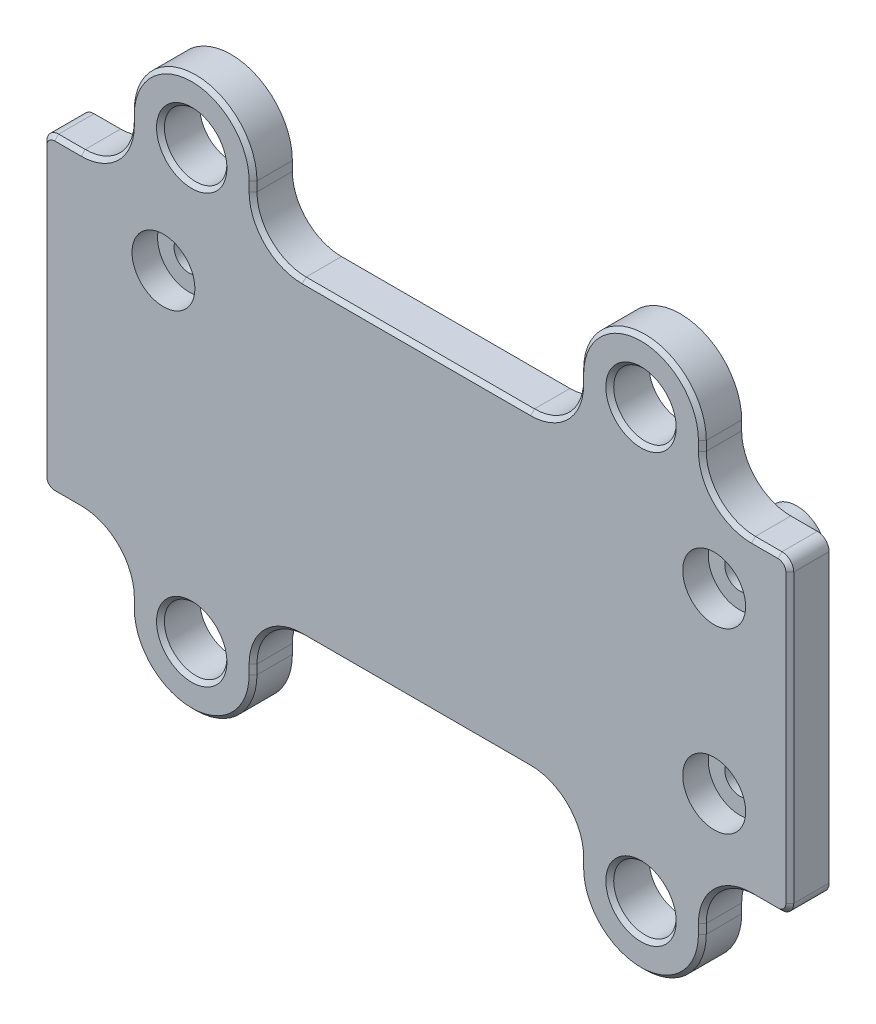
from build123d import *
from build123d.topology import SkipClean

# Parameters (mm, degrees)
SKETCH1_W            = 48.26
SKETCH1_H            = 35.56
BOSS_EXTRUDE1_DEPTH  = 4.445
SKETCH2_OUTSIDE_W    = 62.282
SKETCH2_OUTSIDE_H    = 49.582
CUT_EXTRUDE2_DEPTH   = 61.110724709
SKETCH3_R            = 2.0193
CUT_EXTRUDE3_DEPTH   = 61.110724709
CHAMFER1_SIZE        = 0.254
SKETCH4_OUTSIDE_W    = 62.282
SKETCH4_OUTSIDE_H    = 49.582
SKETCH4_OUTSIDE_W_2  = 12.446
SKETCH4_OUTSIDE_H_2  = 1.524
CUT_EXTRUDE4_DEPTH   = 1.905
SKETCH16_W           = 12.446
SKETCH16_H           = 1.524
BOSS_EXTRUDE12_DEPTH = 1.27
CUT_EXTRUDE5_DEPTH   = 1.016
BOSS_EXTRUDE2_DEPTH  = 1.016
F_3DSKETCH1_R        = 0.9652
F_3DSKETCH1_R_2      = 0.5715
CUT_EXTRUDE6_DEPTH   = 48.4925664
SKETCH7_R            = 0.5715
CUT_EXTRUDE7_DEPTH   = 2.54
SKETCH9_W            = 4.902032443
SKETCH9_H            = 4.572
SKETCH9_R            = 0.9652
SKETCH9_W_2          = 6.35
SKETCH9_H_2          = 4.497155915
SKETCH9_H_3          = 4.013032443
BOSS_EXTRUDE8_DEPTH  = 1.016
SKETCH8_R            = 2.032
CUT_EXTRUDE8_DEPTH   = 1.651
CHAMFER4_SIZE        = 0.127
FILLET1_R            = 3.175
SKETCH11_R           = 1.9558
SKETCH11_R_2         = 0.9652
BOSS_EXTRUDE9_DEPTH  = 2.794
FILLET2_R            = 2.54
FILLET3_R            = 0.7874
BOSS_EXTRUDE10_DEPTH = 1.016
BOSS_EXTRUDE11_DEPTH = 1.016
FILLET4_START        = 1.905
FILLET4_DEPTH        = 2.095
CHAMFER6_DEPTH       = 1.905
DRAFT1_ANGLE         = 3


with BuildPart() as part:
    # Sketch1 → Boss-Extrude1 (new body)
    with BuildSketch(Plane.XY):
        with Locations((24.13, 17.78)):
            Rectangle(SKETCH1_W, SKETCH1_H)
    extrude(amount=BOSS_EXTRUDE1_DEPTH)

    # Sketch2 outside → Cut-Extrude2 (cut, through all)
    with BuildSketch(Plane.XY.offset(4.445)):
        with Locations((24.13, 17.78)):
            Rectangle(SKETCH2_OUTSIDE_W, SKETCH2_OUTSIDE_H)
        with BuildLine():
            Line((0.762, 7.747), (2.4765, 7.747))
            ThreePointArc((2.4765, 7.747), (4.72156403, 6.81706403), (5.6515, 4.572))
            Line((5.6515, 4.572), (5.6515, 3.9624))
            ThreePointArc((5.6515, 3.9624), (9.6139, 0), (13.5763, 3.9624))
            Line((13.5763, 3.9624), (13.5763, 4.572))
            ThreePointArc((13.5763, 4.572), (14.50623597, 6.81706403), (16.7513, 7.747))
            Line((16.7513, 7.747), (31.5087, 7.747))
            ThreePointArc((31.5087, 7.747), (33.75376403, 6.81706403), (34.6837, 4.572))
            Line((34.6837, 4.572), (34.6837, 3.9624))
            ThreePointArc((34.6837, 3.9624), (38.6461, 0), (42.6085, 3.9624))
            Line((42.6085, 3.9624), (42.6085, 4.572))
            ThreePointArc((42.6085, 4.572), (43.53843597, 6.81706403), (45.7835, 7.747))
            Line((45.7835, 7.747), (47.498, 7.747))
            ThreePointArc((47.498, 7.747), (48.036815367, 7.970184633), (48.26, 8.509))
            Line((48.26, 8.509), (48.26, 27.051))
            ThreePointArc((48.26, 27.051), (48.036815367, 27.589815367), (47.498, 27.813))
            Line((47.498, 27.813), (45.7835, 27.813))
            ThreePointArc((45.7835, 27.813), (43.53843597, 28.74293597), (42.6085, 30.988))
            Line((42.6085, 30.988), (42.6085, 31.5976))
            ThreePointArc((42.6085, 31.5976), (38.6461, 35.56), (34.6837, 31.5976))
            Line((34.6837, 31.5976), (34.6837, 30.988))
            ThreePointArc((34.6837, 30.988), (33.75376403, 28.74293597), (31.5087, 27.813))
            Line((31.5087, 27.813), (16.7513, 27.813))
            ThreePointArc((16.7513, 27.813), (14.50623597, 28.74293597), (13.5763, 30.988))
            Line((13.5763, 30.988), (13.5763, 31.5976))
            ThreePointArc((13.5763, 31.5976), (9.6139, 35.56), (5.6515, 31.5976))
            Line((5.6515, 31.5976), (5.6515, 30.988))
            ThreePointArc((5.6515, 30.988), (4.72156403, 28.74293597), (2.4765, 27.813))
            Line((2.4765, 27.813), (0.762, 27.813))
            ThreePointArc((0.762, 27.813), (0.223184633, 27.589815367), (0, 27.051))
            Line((0, 27.051), (0, 8.509))
            ThreePointArc((0, 8.509), (0.223184633, 7.970184633), (0.762, 7.747))
        make_face(mode=Mode.SUBTRACT)
    extrude(amount=-CUT_EXTRUDE2_DEPTH, mode=Mode.SUBTRACT)

    # Sketch3 → Cut-Extrude3 (cut, through all)
    with BuildSketch(Plane.XY.offset(4.445)):
        with Locations((9.6139, 31.5976)):
            Circle(SKETCH3_R)
        with Locations((38.6461, 31.5976)):
            Circle(SKETCH3_R)
        with Locations((38.6461, 3.9624)):
            Circle(SKETCH3_R)
        with Locations((9.6139, 3.9624)):
            Circle(SKETCH3_R)
    extrude(amount=-CUT_EXTRUDE3_DEPTH, mode=Mode.SUBTRACT)

    # Chamfer1
    chamfer1_edges = [part.edges().sort_by_distance(p)[0] for p in [
        (7.5946, 31.5976, 4.445),
        (36.6268, 31.5976, 4.445),
        (36.6268, 3.9624, 4.445),
        (7.5946, 3.9624, 4.445),
        (0, 17.78, 4.445),
        (48.26, 17.78, 4.445),
        (9.6139, 35.56, 4.445),
        (38.6461, 35.56, 4.445),
        (38.6461, 0, 4.445),
        (9.6139, 0, 4.445),
        (4.72156403, 6.81706403, 4.445),
        (1.61925, 7.747, 4.445),
        (0.223184633, 7.970184633, 4.445),
        (0.223184633, 27.589815367, 4.445),
        (1.61925, 27.813, 4.445),
        (4.72156403, 28.74293597, 4.445),
        (5.6515, 31.2928, 4.445),
        (13.5763, 31.2928, 4.445),
        (14.50623597, 28.74293597, 4.445),
        (24.13, 27.813, 4.445),
        (33.75376403, 28.74293597, 4.445),
        (34.6837, 31.2928, 4.445),
        (42.6085, 31.2928, 4.445),
        (43.53843597, 28.74293597, 4.445),
        (46.64075, 27.813, 4.445),
        (48.036815367, 27.589815367, 4.445),
        (48.036815367, 7.970184633, 4.445),
        (46.64075, 7.747, 4.445),
        (43.53843597, 6.81706403, 4.445),
        (42.6085, 4.2672, 4.445),
        (34.6837, 4.2672, 4.445),
        (33.75376403, 6.81706403, 4.445),
        (24.13, 7.747, 4.445),
        (14.50623597, 6.81706403, 4.445),
        (13.5763, 4.2672, 4.445),
        (5.6515, 4.2672, 4.445),
    ]]
    chamfer(chamfer1_edges, length=CHAMFER1_SIZE)

    # Sketch4 outside → Cut-Extrude4 (cut)
    with BuildSketch(Plane(origin=(0, 0, 0), x_dir=(-1, 0, 0), z_dir=(0, 0, -1))):
        with Locations((-24.13, 17.78)):
            Rectangle(SKETCH4_OUTSIDE_W, SKETCH4_OUTSIDE_H)
        with Locations((-22.225, 8.509)):
            Rectangle(SKETCH4_OUTSIDE_W_2, SKETCH4_OUTSIDE_H_2, mode=Mode.SUBTRACT)
    extrude(amount=-CUT_EXTRUDE4_DEPTH, mode=Mode.SUBTRACT)

    # Sketch16 → Boss-Extrude12 (add)
    with BuildSketch(Plane(origin=(0, 0, 0), x_dir=(-1, 0, 0), z_dir=(0, 0, -1))):
        with Locations((-22.225, 8.509)):
            Rectangle(SKETCH16_W, SKETCH16_H)
    extrude(amount=BOSS_EXTRUDE12_DEPTH)

    # Sketch5 → Cut-Extrude5 (cut)
    with BuildSketch(Plane(origin=(0, 0, 1.905), x_dir=(-1, 0, 0), z_dir=(0, 0, -1))):
        with BuildLine():
            Line((-44.6278, 10.414), (-3.6322, 10.414))
            ThreePointArc((-3.6322, 10.414), (-3.039503096, 10.659503096), (-2.794, 11.2522))
            Line((-2.794, 11.2522), (-2.794, 24.3078))
            ThreePointArc((-2.794, 24.3078), (-3.039503096, 24.900496904), (-3.6322, 25.146))
            Line((-3.6322, 25.146), (-44.6278, 25.146))
            ThreePointArc((-44.6278, 25.146), (-45.220496904, 24.900496904), (-45.466, 24.3078))
            Line((-45.466, 24.3078), (-45.466, 11.2522))
            ThreePointArc((-45.466, 11.2522), (-45.220496904, 10.659503096), (-44.6278, 10.414))
        make_face()
    extrude(amount=-CUT_EXTRUDE5_DEPTH, mode=Mode.SUBTRACT)

    # Sketch6 → Boss-Extrude2 (add)
    with BuildSketch(Plane(origin=(0, 0, 1.905), x_dir=(-1, 0, 0), z_dir=(0, 0, -1))):
        with BuildLine():
            Line((-2.54, 9.2075), (-6.553032443, 9.2075))
            Line((-6.553032443, 9.2075), (-6.807032443, 9.4615))
            Line((-6.807032443, 9.4615), (-6.807032443, 10.16))
            Line((-6.807032443, 10.16), (-6.553032443, 10.414))
            Line((-6.553032443, 10.414), (-3.632032443, 10.414))
            ThreePointArc((-3.632032443, 10.414), (-3.03945402, 10.65945402), (-2.794, 11.252032443))
            Line((-2.794, 11.252032443), (-2.794, 14.173032443))
            Line((-2.794, 14.173032443), (-2.54, 14.427032443))
            Line((-2.54, 14.427032443), (-1.905, 14.427032443))
            Line((-1.905, 14.427032443), (-1.651, 14.173032443))
            Line((-1.651, 14.173032443), (-1.651, 10.0965))
            ThreePointArc((-1.651, 10.0965), (-1.911382072, 9.467882072), (-2.54, 9.2075))
        make_face()
        with BuildLine():
            Line((-2.54, 26.3525), (-6.8072, 26.3525))
            Line((-6.8072, 26.3525), (-6.8072, 26.2255))
            Line((-6.8072, 26.2255), (-6.8072, 25.273))
            Line((-6.8072, 25.273), (-6.8072, 25.146))
            Line((-6.8072, 25.146), (-3.632032443, 25.146))
            ThreePointArc((-3.632032443, 25.146), (-3.03945402, 24.90054598), (-2.794, 24.307967557))
            Line((-2.794, 24.307967557), (-2.794, 21.386967557))
            Line((-2.794, 21.386967557), (-2.54, 21.132967557))
            Line((-2.54, 21.132967557), (-1.905, 21.132967557))
            Line((-1.905, 21.132967557), (-1.651, 21.386967557))
            Line((-1.651, 21.386967557), (-1.651, 25.4635))
            ThreePointArc((-1.651, 25.4635), (-1.911382072, 26.092117928), (-2.54, 26.3525))
        make_face()
        with BuildLine():
            Line((-46.609, 10.0965), (-46.609, 14.301381018))
            Line((-46.609, 14.301381018), (-46.609, 14.427032443))
            Line((-46.609, 14.427032443), (-45.593, 14.427032443))
            Line((-45.593, 14.427032443), (-45.466, 14.427032443))
            Line((-45.466, 14.427032443), (-45.466, 11.252032443))
            ThreePointArc((-45.466, 11.252032443), (-45.22054598, 10.65945402), (-44.627967557, 10.414))
            Line((-44.627967557, 10.414), (-40.563967557, 10.414))
            Line((-40.563967557, 10.414), (-40.563967557, 10.287))
            Line((-40.563967557, 10.287), (-40.563967557, 9.3345))
            Line((-40.563967557, 9.3345), (-40.563967557, 9.2075))
            Line((-40.563967557, 9.2075), (-45.72, 9.2075))
            ThreePointArc((-45.72, 9.2075), (-46.348617928, 9.467882072), (-46.609, 10.0965))
        make_face()
        with BuildLine():
            Line((-45.593, 21.132967557), (-46.609, 21.132967557))
            Line((-46.609, 21.132967557), (-46.609, 21.2598))
            Line((-46.609, 21.2598), (-46.609, 25.4635))
            ThreePointArc((-46.609, 25.4635), (-46.348617928, 26.092117928), (-45.72, 26.3525))
            Line((-45.72, 26.3525), (-40.563967557, 26.3525))
            Line((-40.563967557, 26.3525), (-40.563967557, 26.2255))
            Line((-40.563967557, 26.2255), (-40.563967557, 25.273))
            Line((-40.563967557, 25.273), (-40.563967557, 25.146))
            Line((-40.563967557, 25.146), (-44.627967557, 25.146))
            ThreePointArc((-44.627967557, 25.146), (-45.22054598, 24.90054598), (-45.466, 24.307967557))
            Line((-45.466, 24.307967557), (-45.466, 21.132967557))
            Line((-45.466, 21.132967557), (-45.593, 21.132967557))
        make_face()
        Polygon((-26.5176, 26.0985), (-26.2636, 26.3525), (-21.9964, 26.3525), (-21.7424, 26.0985), (-21.7424, 25.4), (-21.9964, 25.146), (-26.2636, 25.146), (-26.5176, 25.4), align=None)
    extrude(amount=BOSS_EXTRUDE2_DEPTH)

    # 3DSketch1 → Cut-Extrude6 (cut, through all)
    # profile 1 of 3: a face of its own
    with BuildSketch(Plane(origin=(7.786455915, 23.823844085, -2.6162), x_dir=(0.9516958120786183, -0.3070424747034511, 0), z_dir=(0, 0, 1))):
        with Locations(Location((33.866476151, 10.926229279, 0), (0, 0, 17.88108636))):
            Circle(F_3DSKETCH1_R)
        with Locations(Location((33.866476151, 10.926229279, 0), (0, 0, 17.88108636))):
            Circle(F_3DSKETCH1_R_2, mode=Mode.SUBTRACT)
    # profile 2 of 3: a face of its own
    with BuildSketch(Plane(origin=(7.786455915, 23.823844085, -2.6162), x_dir=(0.9516958120786183, -0.3070424747034511, 0), z_dir=(0, 0, 1))):
        with Locations(Location((37.391569395, 0, 0), (0, 0, 17.88108636))):
            Circle(F_3DSKETCH1_R)
        with Locations(Location((37.391569395, 0, 0), (0, 0, 17.88108636))):
            Circle(F_3DSKETCH1_R_2, mode=Mode.SUBTRACT)
    # profile 3 of 3: a face of its own
    with BuildSketch(Plane(origin=(7.786455915, 23.823844085, -2.6162), x_dir=(0.9516958120786183, -0.3070424747034511, 0), z_dir=(0, 0, 1))):
        with Locations(Location((0, 0, 0), (0, 0, 17.88108636))):
            Circle(F_3DSKETCH1_R)
        with Locations(Location((0, 0, 0), (0, 0, 17.88108636))):
            Circle(F_3DSKETCH1_R_2, mode=Mode.SUBTRACT)
    extrude(amount=CUT_EXTRUDE6_DEPTH, mode=Mode.SUBTRACT)


with BuildPart() as cut_extrude6_piece_1:
    # of the separate pieces the step leaves, piece 1, a body of its own (cut_extrude6_pieces)
    add(part.part.solids().sort_by_distance((5.6515, 3.9624, 4.191))[0])

    # Sketch9 → Boss-Extrude8 (add)
    # profile 1 of 3: a face of its own
    with BuildSketch(Plane(origin=(0, 0, 2.921), x_dir=(-1, 0, 0), z_dir=(0, 0, -1))):
        with Locations((-43.014983779, 12.7)):
            Rectangle(SKETCH9_W, SKETCH9_H)
        with Locations(Location((-43.371855915, 12.343044085, 0), (0, 0, 180))):
            Circle(SKETCH9_R, mode=Mode.SUBTRACT)
    # profile 2 of 3: a face of its own
    with BuildSketch(Plane(origin=(0, 0, 2.921), x_dir=(-1, 0, 0), z_dir=(0, 0, -1))):
        with Locations((-7.786455915, 22.897422043)):
            Rectangle(SKETCH9_W_2, SKETCH9_H_2)
        with Locations(Location((-7.786455915, 23.823844085, 0), (0, 0, 180))):
            Circle(SKETCH9_R, mode=Mode.SUBTRACT)
    # profile 3 of 3: a face of its own
    with BuildSketch(Plane(origin=(0, 0, 2.921), x_dir=(-1, 0, 0), z_dir=(0, 0, -1))):
        with Locations((-43.014983779, 23.139483779)):
            Rectangle(SKETCH9_W, SKETCH9_H_3)
        with Locations(Location((-43.371855915, 23.823844085, 0), (0, 0, 180))):
            Circle(SKETCH9_R, mode=Mode.SUBTRACT)
    extrude(amount=BOSS_EXTRUDE8_DEPTH)

    # Sketch8 → Cut-Extrude8 (cut)
    with BuildSketch(Plane.XY.offset(4.445)):
        with Locations((7.786455915, 23.823844085)):
            Circle(SKETCH8_R)
        with Locations((43.371855915, 23.823844085)):
            Circle(SKETCH8_R)
        with Locations((43.371855915, 12.343044085)):
            Circle(SKETCH8_R)
    extrude(amount=-CUT_EXTRUDE8_DEPTH, mode=Mode.SUBTRACT)

    # Chamfer4
    chamfer4_edges = [cut_extrude6_piece_1.edges().sort_by_distance(p)[0] for p in [
        (24.13, 26.3525, 0.889),
        (26.3906, 26.2255, 0.889),
        (26.5176, 25.74925, 0.889),
        (26.3906, 25.273, 0.889),
        (24.13, 25.146, 0.889),
        (21.8694, 25.273, 0.889),
        (21.7424, 25.74925, 0.889),
        (21.8694, 26.2255, 0.889),
    ]]
    chamfer(chamfer4_edges, length=CHAMFER4_SIZE)

    # Fillet1
    fillet1_edges = [cut_extrude6_piece_1.edges().sort_by_distance(p)[0] for p in [
        (10.961455915, 20.648844085, 2.413),
        (4.611455915, 20.648844085, 2.413),
    ]]
    fillet(fillet1_edges, radius=FILLET1_R - 0.0001)  # a hair under: the kernel refuses the full size

    # Sketch11 → Boss-Extrude9 (add)
    # profile 1 of 3: a face of its own
    with BuildSketch(Plane(origin=(0, 0, 1.905), x_dir=(-1, 0, 0), z_dir=(0, 0, -1))):
        with Locations(Location((-43.371855915, 23.823844085, 0), (0, 0, 138.510032486))):
            Circle(SKETCH11_R)
        with Locations(Location((-43.371855915, 23.823844085, 0), (0, 0, 180))):
            Circle(SKETCH11_R_2, mode=Mode.SUBTRACT)
    # profile 2 of 3: a face of its own
    with BuildSketch(Plane(origin=(0, 0, 1.905), x_dir=(-1, 0, 0), z_dir=(0, 0, -1))):
        with Locations(Location((-43.371855915, 12.343044085, 0), (0, 0, 260.511847353))):
            Circle(SKETCH11_R)
        with Locations(Location((-43.371855915, 12.343044085, 0), (0, 0, 180))):
            Circle(SKETCH11_R_2, mode=Mode.SUBTRACT)
    # profile 3 of 3: a face of its own
    with BuildSketch(Plane(origin=(0, 0, 1.905), x_dir=(-1, 0, 0), z_dir=(0, 0, -1))):
        with Locations(Location((-7.786455915, 23.823844085, 0), (0, 0, 59.954122435))):
            Circle(SKETCH11_R)
        with Locations(Location((-7.786455915, 23.823844085, 0), (0, 0, 180))):
            Circle(SKETCH11_R_2, mode=Mode.SUBTRACT)
    extrude(amount=BOSS_EXTRUDE9_DEPTH)

    # Fillet2
    fillet2_edges = [cut_extrude6_piece_1.edges().sort_by_distance(p)[0] for p in [
        (40.563967557, 21.132967557, 2.413),
        (40.563967557, 14.986, 2.413),
    ]]
    fillet(fillet2_edges, radius=FILLET2_R)

    # Fillet3
    # the kernel refuses this fillet: 0.7874 mm, written as the material it adds along each edge
    with BuildSketch(Plane(origin=(41.930655936, 25.146, 0.889), x_dir=(-1, 0, 0), z_dir=(0, 0, 1))) as fillet3_piece_1:
        with BuildLine():
            CenterArc((1.249372889, 0.7874), FILLET3_R, 168.758855809, 101.241144191)
            Line((0.477078825, 0.940894753), (0.461632944, 0.943964648))
            ThreePointArc((0.461632944, 0.943964648), (0.289129693, 0.444795675), (-0.011604467, 0.010645931))
            Line((-0.011604467, 0.010645931), (0, -0.015748))
            Line((0, -0.015748), (1.249372889, -0.015748))
            Line((1.249372889, -0.015748), (1.249372889, 0))
        make_face()
    extrude(amount=1.016)
    with BuildSketch(Plane(origin=(43.049454679, 10.414, 0.889), x_dir=(-1, 0, 0), z_dir=(0, 0, 1))) as fillet3_piece_2:
        with BuildLine():
            CenterArc((2.17195139, -0.7874), FILLET3_R, 90, 114.593168844)
            Line((1.455979803, -1.115094136), (1.441660371, -1.121648018))
            ThreePointArc((1.441660371, -1.121648018), (0.857216562, -0.388815656), (-0.002595958, -0.015532563))
            Line((-0.002595958, -0.015532563), (0, 0.015748))
            Line((0, 0.015748), (2.17195139, 0.015748))
            Line((2.17195139, 0.015748), (2.17195139, 0))
        make_face()
    extrude(amount=1.016)
    with BuildSketch(Plane(origin=(6.345255936, 25.146, 0.889), x_dir=(-0.4522354245640404, -0.8918986045338236, 0), z_dir=(0, 0, 1))) as fillet3_piece_3:
        with BuildLine():
            CenterArc((1.26729164, -0.758223763), FILLET3_R, 105.646052984, 101.241144191)
            Line((0.565010679, -1.114313936), (0.550965059, -1.121435739))
            Line((0.550965059, -1.121435739), (-0.014045619, -0.007121803))
            Line((-0.014045619, -0.007121803), (0.00424714, 0.015164475))
            ThreePointArc((0.00424714, 0.015164475), (0.527467331, -0.056722009), (1.050687523, 0.015164475))
            Line((1.050687523, 0.015164475), (1.054934662, 0))
        make_face()
    extrude(amount=1.016)
    with BuildSketch(Plane(origin=(6.8072, 25.516833008, 1.905), x_dir=(5.384336008781321e-12, 1.0, 0), z_dir=(0, 0, -1))) as fillet3_piece_4:
        with BuildLine():
            CenterArc((1.041437811, 0.760037585), FILLET3_R, 175.416414294, 79.434623289)
            Line((0.256556063, 0.822961364), (0.240858428, 0.82421984))
            ThreePointArc((0.240858428, 0.82421984), (0.159148279, 0.401856963), (-0.013631859, 0.007884918))
            Line((-0.013631859, 0.007884918), (0, -0.015748))
            ThreePointArc((0, -0.015748), (0.417833496, -0.015748), (0.831551575, -0.015200752))
            Line((0.831551575, -0.015200752), (0.835666992, 0))
        make_face()
    extrude(amount=1.016)

    # Sketch14 → Boss-Extrude10 (add)
    with BuildSketch(Plane(origin=(0, 0, 1.905), x_dir=(-1, 0, 0), z_dir=(0, 0, -1))):
        with BuildLine():
            Line((-45.466, 21.645595789), (-45.466, 24.307967557))
            ThreePointArc((-45.466, 24.307967557), (-45.290305275, 24.821394399), (-44.836890412, 25.119539868))
            ThreePointArc((-44.836890412, 25.119539868), (-44.654501698, 25.300317395), (-44.45, 25.455640326))
            Line((-44.45, 25.455640326), (-44.45, 22.192047845))
            ThreePointArc((-44.45, 22.192047845), (-45.121284698, 22.222411585), (-45.466, 21.645595789))
        make_face()
    extrude(amount=BOSS_EXTRUDE10_DEPTH)

    # Sketch15 → Boss-Extrude11 (add)
    with BuildSketch(Plane(origin=(0, 0, 1.905), x_dir=(-1, 0, 0), z_dir=(0, 0, -1))):
        with BuildLine():
            Line((-45.466, 11.252032443), (-45.466, 14.427032443))
            ThreePointArc((-45.466, 14.427032443), (-44.993320854, 13.978588304), (-44.344640805, 14.039759499))
            ThreePointArc((-44.344640805, 14.039759499), (-44.271144143, 14.079832594), (-44.196, 14.116723923))
            Line((-44.196, 14.116723923), (-44.45, 13.251247845))
            Line((-44.45, 13.251247845), (-44.45, 10.711247845))
            ThreePointArc((-44.45, 10.711247845), (-44.087726622, 10.522966403), (-43.69425715, 10.414))
            Line((-43.69425715, 10.414), (-44.627967557, 10.414))
            ThreePointArc((-44.627967557, 10.414), (-45.22054598, 10.65945402), (-45.466, 11.252032443))
        make_face()
    extrude(amount=BOSS_EXTRUDE11_DEPTH)

    # Fillet4: read off the stored shape, not the designer's step
    # Fillet4 outline → Fillet4 (add)
    with BuildSketch(Plane.XY.offset(FILLET4_START)):
        with BuildLine():
            Line((10.961455915, 25.146), (10.961455915, 24.3586))
            ThreePointArc((10.961455915, 24.3586), (11.192080035, 24.91537588), (11.748855915, 25.146))
            Line((11.748855915, 25.146), (10.961455915, 25.146))
        make_face()
        with BuildLine():
            Line((40.563967557, 25.146), (39.776567557, 25.146))
            ThreePointArc((39.776567557, 25.146), (40.333343437, 24.91537588), (40.563967557, 24.3586))
            Line((40.563967557, 24.3586), (40.563967557, 25.146))
        make_face()
        with BuildLine():
            Line((4.611455915, 25.146), (3.824055915, 25.146))
            ThreePointArc((3.824055915, 25.146), (4.380831794, 24.915375879), (4.611455915, 24.3586))
            Line((4.611455915, 24.3586), (4.611455915, 25.146))
        make_face()
        with BuildLine():
            Line((40.563967557, 10.414), (40.563967557, 11.2014))
            ThreePointArc((40.563967557, 11.2014), (40.333343437, 10.64462412), (39.776567557, 10.414))
            Line((39.776567557, 10.414), (40.563967557, 10.414))
        make_face()
        with BuildLine():
            Line((45.466, 14.986), (45.466, 15.7734))
            ThreePointArc((45.466, 15.7734), (45.23537588, 15.21662412), (44.6786, 14.986))
            Line((44.6786, 14.986), (45.466, 14.986))
        make_face()
        with BuildLine():
            ThreePointArc((44.6786, 21.132967557), (45.235375879, 20.902343436), (45.466, 20.345567557))
            Line((45.466, 20.345567557), (45.466, 21.132967557))
            Line((45.466, 21.132967557), (44.6786, 21.132967557))
        make_face()
    extrude(amount=FILLET4_DEPTH)

    # Chamfer6: read off the stored shape, not the designer's step
    # Chamfer6 outline → Chamfer6 (cut)
    with SkipClean():  # the faces are left unmerged after this step: merging them gives an invalid solid
        with BuildSketch(Plane.XY):
            with BuildLine():
                Line((6.619572376, 26.3525), (6.917378711, 26.113656149))
                ThreePointArc((6.917378711, 26.113656149), (6.852245555, 26.228444868), (6.8072, 26.3525))
                Line((6.8072, 26.3525), (6.619572376, 26.3525))
            make_face()
            Polygon((45.466, 21.132967557), (45.72, 21.132967557), (45.466, 21.386967557), align=None)
            Polygon((46.609, 21.386967557), (46.355, 21.132967557), (46.609, 21.132967557), align=None)
            Polygon((40.563967557, 26.3525), (40.563967557, 26.0985), (40.817967557, 26.3525), align=None)
            with BuildLine():
                Line((40.784629872, 25.139188364), (40.563967557, 25.390991062))
                Line((40.563967557, 25.390991062), (40.563967557, 25.146))
                Line((40.563967557, 25.146), (40.681283048, 25.146))
                ThreePointArc((40.681283048, 25.146), (40.733068578, 25.144295246), (40.784629872, 25.139188364))
            make_face()
            Polygon((46.609, 14.427032443), (46.355, 14.427032443), (46.609, 14.173032443), align=None)
            with BuildLine():
                Line((45.279998761, 14.15331758), (45.926936637, 14.427032443))
                Line((45.926936637, 14.427032443), (45.466, 14.427032443))
                ThreePointArc((45.466, 14.427032443), (45.387541521, 14.28029299), (45.279998761, 14.15331758))
            make_face()
            Polygon((40.563967557, 10.414), (40.563967557, 10.16), (40.817967557, 10.414), align=None)
            Polygon((40.817967557, 9.2075), (40.563967557, 9.4615), (40.563967557, 9.2075), align=None)
        extrude(amount=CHAMFER6_DEPTH, mode=Mode.SUBTRACT)

    # Draft1
    draft1_faces = [cut_extrude6_piece_1.faces().sort_by_distance(p)[0] for p in [
        (16.002, 8.509, 0.3175),
        (28.448, 8.509, 0.3175),
    ]]
    draft(draft1_faces, Plane(origin=(0, 0, 1.905), x_dir=(-1, 0, 0), z_dir=(0, 0, -1)), DRAFT1_ANGLE)


with BuildPart() as cut_extrude6_piece_2:
    # of the separate pieces the step leaves, piece 2, a body of its own (cut_extrude6_pieces)
    add(part.part.solids().sort_by_distance((8.357955915, 23.823844085, 4.445))[0])


with BuildPart() as cut_extrude6_piece_3:
    # of the separate pieces the step leaves, piece 3, a body of its own (cut_extrude6_pieces)
    add(part.part.solids().sort_by_distance((43.943355915, 12.343044085, 4.445))[0])


with BuildPart() as cut_extrude6_piece_4:
    # of the separate pieces the step leaves, piece 4, a body of its own (cut_extrude6_pieces)
    add(part.part.solids().sort_by_distance((43.943355915, 23.823844085, 4.445))[0])


with BuildPart() as cut_extrude7_tool:
    # Sketch7 → Cut-Extrude7 (new body)
    with BuildSketch(Plane.XY.offset(4.445)):
        with Locations((7.786455915, 23.823844085)):
            Circle(SKETCH7_R)
        with Locations((43.371855915, 23.823844085)):
            Circle(SKETCH7_R)
        with Locations((43.371855915, 12.343044085)):
            Circle(SKETCH7_R)
    extrude(amount=-CUT_EXTRUDE7_DEPTH)


with BuildPart() as cut_extrude6_piece_2_1:
    add(cut_extrude6_piece_2.part)

    # Cut-Extrude7: cut by cut_extrude7_tool
    add(cut_extrude7_tool.part, mode=Mode.SUBTRACT)


with BuildPart() as cut_extrude6_piece_3_1:
    add(cut_extrude6_piece_3.part)

    # Cut-Extrude7: cut by cut_extrude7_tool
    add(cut_extrude7_tool.part, mode=Mode.SUBTRACT)


with BuildPart() as cut_extrude6_piece_4_1:
    add(cut_extrude6_piece_4.part)

    # Cut-Extrude7: cut by cut_extrude7_tool
    add(cut_extrude7_tool.part, mode=Mode.SUBTRACT)


solid = cut_extrude6_piece_1.part
